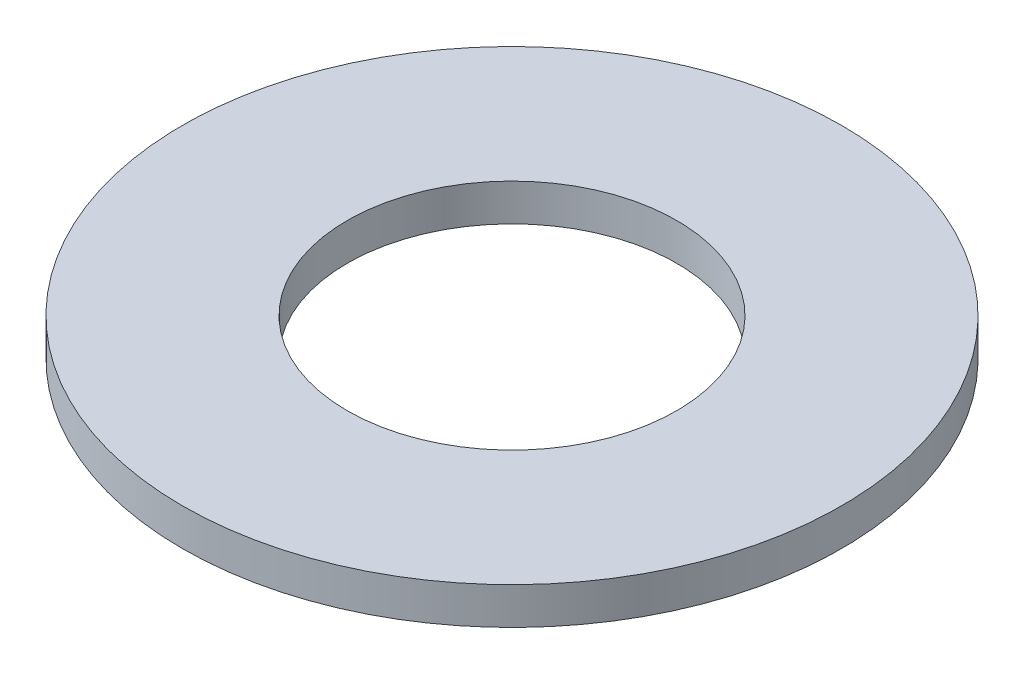
from build123d import *

# Parameters (mm, degrees)
SKETCH1_R           = 80
BOSS_EXTRUDE1_DEPTH = 9
SKETCH2_R           = 40
CUT_EXTRUDE1_DEPTH  = 114.494493258


with BuildPart() as part:
    # Sketch1 → Boss-Extrude1 (new body)
    with BuildSketch(Plane(origin=(0, 0, 0), x_dir=(1, 0, 0), z_dir=(0, 1, 0))):
        Circle(SKETCH1_R)
    extrude(amount=BOSS_EXTRUDE1_DEPTH)

    # Sketch2 → Cut-Extrude1 (cut, through all)
    with BuildSketch(Plane(origin=(0, 0, 0), x_dir=(1, 0, 0), z_dir=(0, 1, 0))):
        Circle(SKETCH2_R)
    extrude(amount=CUT_EXTRUDE1_DEPTH, mode=Mode.SUBTRACT)


solid = part.part
